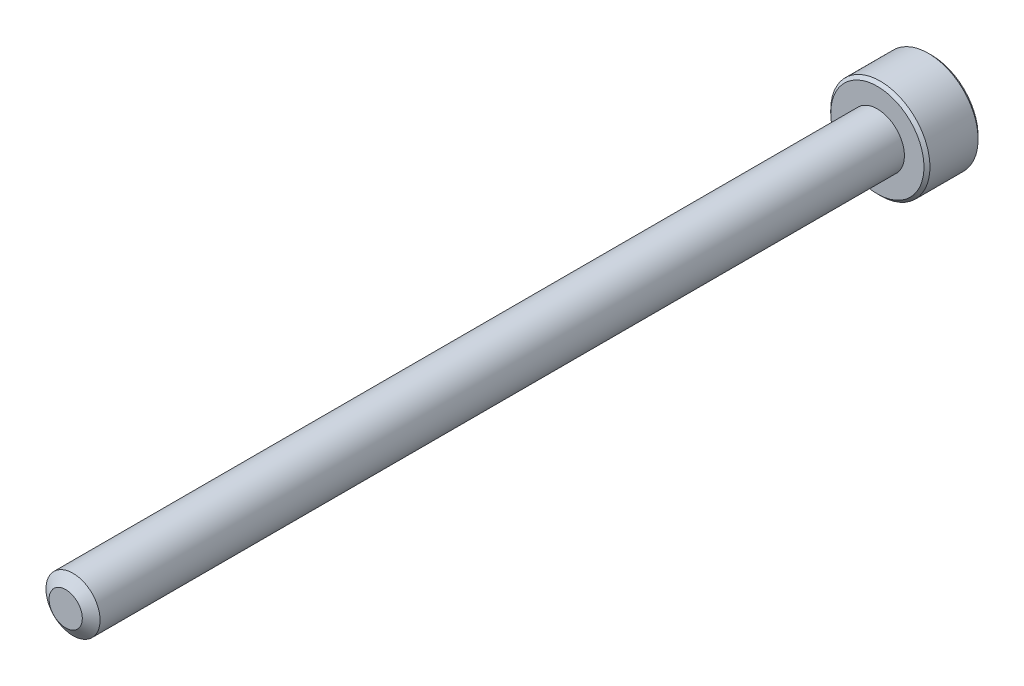
from build123d import *

# Parameters (mm, degrees)
SKETCH1_R          = 1.5
EXTRUDE1_DEPTH     = 45
SKETCH6_R          = 2.75
EXTRUDE2_DEPTH     = 3
CUT_EXTRUDE1_DEPTH = 1.875
CHAMFER1_SIZE      = 0.165


with BuildPart() as part:
    # Sketch1 → Extrude1 (new body)
    with BuildSketch(Plane.XY):
        Circle(SKETCH1_R)
    extrude(amount=-EXTRUDE1_DEPTH)

    # Sketch4 → Cut-Revolve1 (revolve, cut)
    with BuildSketch(Plane(origin=(0, 0, 0), x_dir=(0, 0, -1), z_dir=(1, 0, 0))):
        Polygon((0.405251783, 1.5), (0, 0.921240474), (0, 1.5), align=None)
    revolve(axis=Axis((0, 0, 0), (0, 0, -1)), mode=Mode.SUBTRACT)

    # Sketch6 → Extrude2 (add)
    with BuildSketch(Plane(origin=(0, 0, -45), x_dir=(-1, 0, 0), z_dir=(0, 0, -1))):
        Circle(SKETCH6_R)
    extrude(amount=EXTRUDE2_DEPTH)

    # Sketch7 → Cut-Extrude1 (cut)
    with BuildSketch(Plane(origin=(0, 0, -48), x_dir=(-1, 0, 0), z_dir=(0, 0, -1))):
        Polygon((0, 1.443375673), (-1.25, 0.721687836), (-1.25, -0.721687836), (0, -1.443375673), (1.25, -0.721687836), (1.25, 0.721687836), align=None)
    extrude(amount=-CUT_EXTRUDE1_DEPTH, mode=Mode.SUBTRACT)

    # Cut-Extrude2 cone 1 section (through the dimple's axis) → Cut-Extrude2 (revolve, cut)
    with BuildSketch(Plane(origin=(0, 0, -48), x_dir=(0, 1, 0), z_dir=(1, 0, 0))):
        Polygon((0, 0), (1.443375673, 0), (0, 1.443375673), align=None)
    revolve(axis=Axis((0, 0, -48), (0, 0, 1)), mode=Mode.SUBTRACT)

    # Chamfer1
    chamfer1_edges = [part.edges().sort_by_distance(p)[0] for p in [
        (2.75, 0, -48),
        (2.75, 0, -45),
    ]]
    chamfer(chamfer1_edges, length=CHAMFER1_SIZE)


solid = part.part
